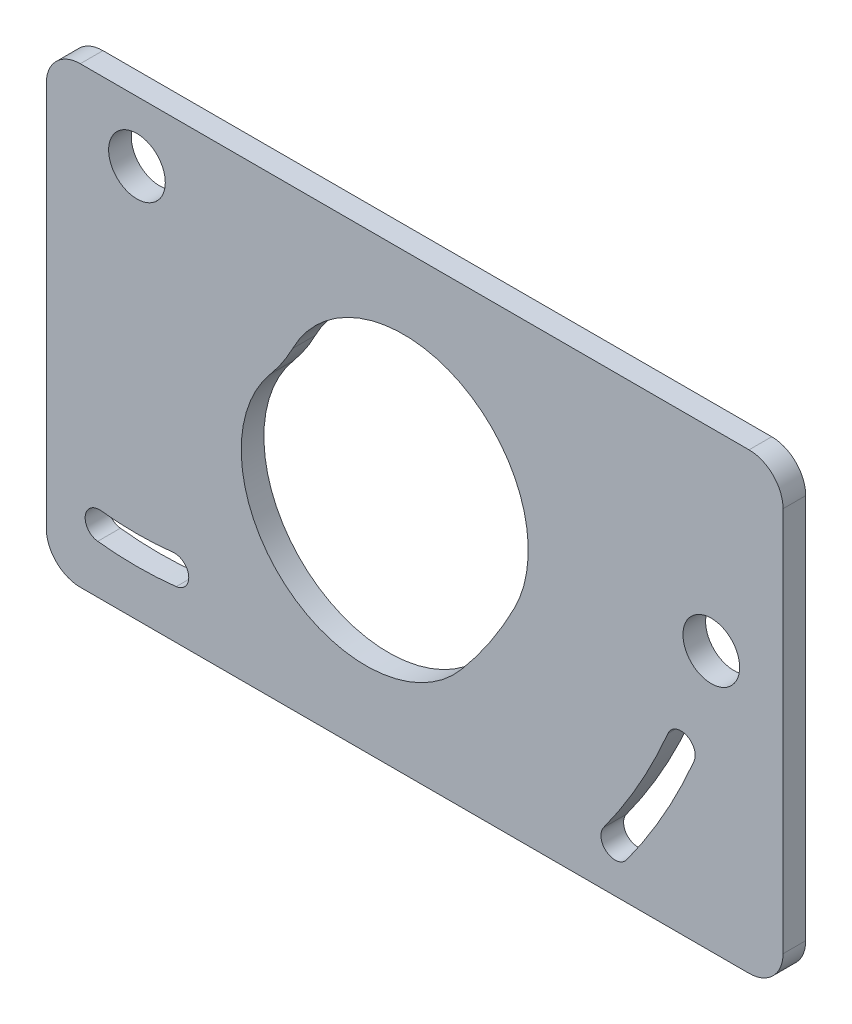
from build123d import *

# Parameters (mm, degrees)
SZKIC1_R                    = 2.5
DODANIE_WYCI_GNI_CIE1_DEPTH = 2


with BuildPart() as part:
    # Szkic1 → Dodanie-wyciągnięcie1 (new body)
    with BuildSketch(Plane.XY):
        with BuildLine():
            ThreePointArc((-30, -17), (-29.121320344, -19.121320344), (-27, -20))
            Line((-27, -20), (32, -20))
            ThreePointArc((32, -20), (34.121320344, -19.121320344), (35, -17))
            Line((35, -17), (35, 17))
            ThreePointArc((35, 17), (34.121320344, 19.121320344), (32, 20))
            Line((32, 20), (-27, 20))
            ThreePointArc((-27, 20), (-29.121320344, 19.121320344), (-30, 17))
            Line((-30, 17), (-30, -17))
        make_face()
        with Locations((28.667243369, 2.969211841)):
            Circle(SZKIC1_R, mode=Mode.SUBTRACT)
        with BuildLine():
            ThreePointArc((24.849514344, -5.236229797), (26.488756334, -4.574500475), (27.150485656, -6.213742466))
            ThreePointArc((27.150485656, -6.213742466), (24.470809822, -11.643513117), (21.193691844, -16.735032503))
            ThreePointArc((21.193691844, -16.735032503), (19.44760681, -17.011052531), (19.171586782, -15.264967497))
            ThreePointArc((19.171586782, -15.264967497), (22.295287061, -10.411806693), (24.849514344, -5.236229797))
        make_face(mode=Mode.SUBTRACT)
        with BuildLine():
            ThreePointArc((-18.537868379, -15.720072586), (-22, -15.916666667), (-25.462131621, -15.720072586))
            ThreePointArc((-25.462131621, -15.720072586), (-26.562592423, -14.336603749), (-25.179123587, -13.236142947))
            ThreePointArc((-25.179123587, -13.236142947), (-22, -13.416666667), (-18.820876413, -13.236142947))
            ThreePointArc((-18.820876413, -13.236142947), (-17.437407577, -14.336603749), (-18.537868379, -15.720072586))
        make_face(mode=Mode.SUBTRACT)
        with BuildLine():
            ThreePointArc((11.303346225, -2.441630943), (9.152553238, -6.101702158), (6.601254034, -9.49476923))
            ThreePointArc((6.601254034, -9.49476923), (-8.900310954, -10.799178264), (-10.204719988, 4.702386724))
            ThreePointArc((-10.204719988, 4.702386724), (-9.152553238, 6.101702158), (-8.265556972, 7.611131249))
            ThreePointArc((-8.265556972, 7.611131249), (6.545275723, 12.369201751), (11.303346225, -2.441630943))
        make_face(mode=Mode.SUBTRACT)
        with Locations((-22, 14.666666667)):
            Circle(SZKIC1_R, mode=Mode.SUBTRACT)
    extrude(amount=DODANIE_WYCI_GNI_CIE1_DEPTH)


solid = part.part
